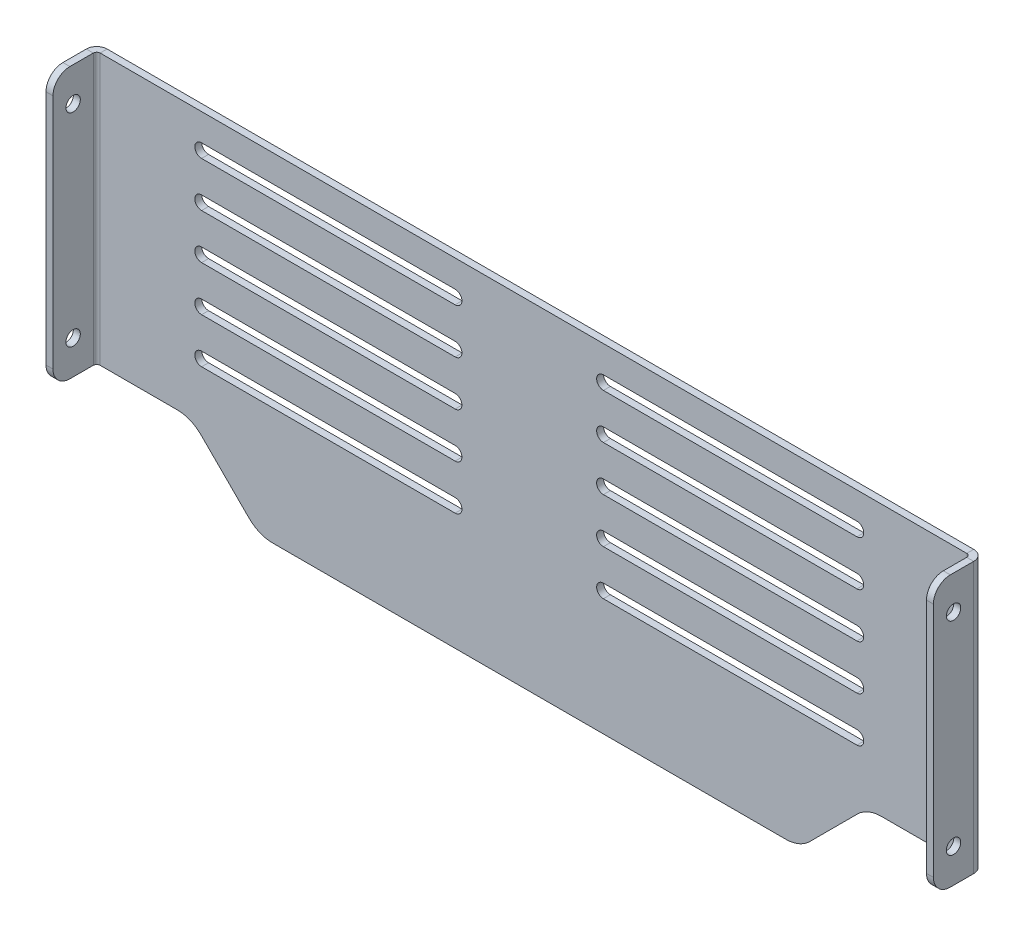
from build123d import *

# Parameters (mm, degrees)
BASE_FLANGE1_DEPTH  = 80
SKETCH6_R           = 2.125
CUT_EXTRUDE1_DEPTH  = 275.800838609
FILLET1_R           = 5
BOSS_EXTRUDE1_DEPTH = 2.06
FILLET2_R           = 10
CUT_EXTRUDE2_DEPTH  = 10


# Read off the part's stored shape, not the designer's step: Base-Flange1
with BuildPart() as part:
    # Base-Flange1 outline → Base-Flange1 (new body)
    with BuildSketch(Plane(origin=(0, 0, 0), x_dir=(1, 0, 0), z_dir=(0, 1, 0))):
        with BuildLine():
            Line((-130, -3.076), (-130, -15))
            Line((-130, -15), (-127.94, -15))
            Line((-127.94, -15), (-127.94, -3.076))
            ThreePointArc((-127.94, -3.076), (-127.64242049, -2.35757951), (-126.924, -2.06))
            Line((-126.924, -2.06), (129.394, -2.06))
            ThreePointArc((129.394, -2.06), (130.11242049, -2.35757951), (130.41, -3.076))
            Line((130.41, -3.076), (130.41, -15))
            Line((130.41, -15), (132.47, -15))
            Line((132.47, -15), (132.47, -3.076))
            ThreePointArc((132.47, -3.076), (131.569060459, -0.900939541), (129.394, 0))
            Line((129.394, 0), (-126.924, 0))
            ThreePointArc((-126.924, 0), (-129.099060459, -0.900939541), (-130, -3.076))
        make_face()
    extrude(amount=BASE_FLANGE1_DEPTH)

    # Sketch6 → Cut-Extrude1 (cut, through all)
    with BuildSketch(Plane.ZY.offset(130)):
        with Locations((9.038, 70)):
            Circle(SKETCH6_R)
        with Locations((9.038, 10)):
            Circle(SKETCH6_R)
    extrude(amount=-CUT_EXTRUDE1_DEPTH, mode=Mode.SUBTRACT)

    # Fillet1
    fillet1_edges = [part.edges().sort_by_distance(p)[0] for p in [
        (131.44, 0, 15),
        (-128.97, 0, 15),
        (131.44, 80, 15),
        (-128.97, 80, 15),
    ]]
    fillet(fillet1_edges, radius=FILLET1_R)

    # Sketch7 → Boss-Extrude1 (add)
    with BuildSketch(Plane.XY.offset(2.06)):
        Polygon((-100, 0), (-80, -20), (80, -20), (100, 0), align=None)
    extrude(amount=-BOSS_EXTRUDE1_DEPTH)

    # Fillet2
    fillet2_edges = [part.edges().sort_by_distance(p)[0] for p in [
        (-100, 0, 1.03),
        (100, 0, 1.03),
        (80, -20, 1.03),
        (-80, -20, 1.03),
    ]]
    fillet(fillet2_edges, radius=FILLET2_R)

    # Sketch8 → Cut-Extrude2 (cut)
    with BuildSketch(Plane.XY.offset(2.06)):
        with BuildLine():
            Line((-96.924, 72), (-21.924, 72))
            ThreePointArc((-21.924, 72), (-19.924, 70), (-21.924, 68))
            Line((-21.924, 68), (-96.924, 68))
            ThreePointArc((-96.924, 68), (-98.924, 70), (-96.924, 72))
        make_face()
        with BuildLine():
            Line((-96.924, 58.66), (-21.924, 58.66))
            ThreePointArc((-21.924, 58.66), (-19.924, 56.66), (-21.924, 54.66))
            Line((-21.924, 54.66), (-96.924, 54.66))
            ThreePointArc((-96.924, 54.66), (-98.924, 56.66), (-96.924, 58.66))
        make_face()
        with BuildLine():
            Line((-96.924, 45.32), (-21.924, 45.32))
            ThreePointArc((-21.924, 45.32), (-19.924, 43.32), (-21.924, 41.32))
            Line((-21.924, 41.32), (-96.924, 41.32))
            ThreePointArc((-96.924, 41.32), (-98.924, 43.32), (-96.924, 45.32))
        make_face()
        with BuildLine():
            Line((-96.924, 31.98), (-21.924, 31.98))
            ThreePointArc((-21.924, 31.98), (-19.924, 29.98), (-21.924, 27.98))
            Line((-21.924, 27.98), (-96.924, 27.98))
            ThreePointArc((-96.924, 27.98), (-98.924, 29.98), (-96.924, 31.98))
        make_face()
        with BuildLine():
            Line((-96.924, 18.64), (-21.924, 18.64))
            ThreePointArc((-21.924, 18.64), (-19.924, 16.64), (-21.924, 14.64))
            Line((-21.924, 14.64), (-96.924, 14.64))
            ThreePointArc((-96.924, 14.64), (-98.924, 16.64), (-96.924, 18.64))
        make_face()
        with BuildLine():
            Line((96.924, 72), (21.924, 72))
            ThreePointArc((21.924, 72), (19.924, 70), (21.924, 68))
            Line((21.924, 68), (96.924, 68))
            ThreePointArc((96.924, 68), (98.924, 70), (96.924, 72))
        make_face()
        with BuildLine():
            Line((96.924, 58.66), (21.924, 58.66))
            ThreePointArc((21.924, 58.66), (19.924, 56.66), (21.924, 54.66))
            Line((21.924, 54.66), (96.924, 54.66))
            ThreePointArc((96.924, 54.66), (98.924, 56.66), (96.924, 58.66))
        make_face()
        with BuildLine():
            Line((96.924, 45.32), (21.924, 45.32))
            ThreePointArc((21.924, 45.32), (19.924, 43.32), (21.924, 41.32))
            Line((21.924, 41.32), (96.924, 41.32))
            ThreePointArc((96.924, 41.32), (98.924, 43.32), (96.924, 45.32))
        make_face()
        with BuildLine():
            Line((96.924, 31.98), (21.924, 31.98))
            ThreePointArc((21.924, 31.98), (19.924, 29.98), (21.924, 27.98))
            Line((21.924, 27.98), (96.924, 27.98))
            ThreePointArc((96.924, 27.98), (98.924, 29.98), (96.924, 31.98))
        make_face()
        with BuildLine():
            Line((96.924, 18.64), (21.924, 18.64))
            ThreePointArc((21.924, 18.64), (19.924, 16.64), (21.924, 14.64))
            Line((21.924, 14.64), (96.924, 14.64))
            ThreePointArc((96.924, 14.64), (98.924, 16.64), (96.924, 18.64))
        make_face()
    extrude(amount=-CUT_EXTRUDE2_DEPTH, mode=Mode.SUBTRACT)


solid = part.part
